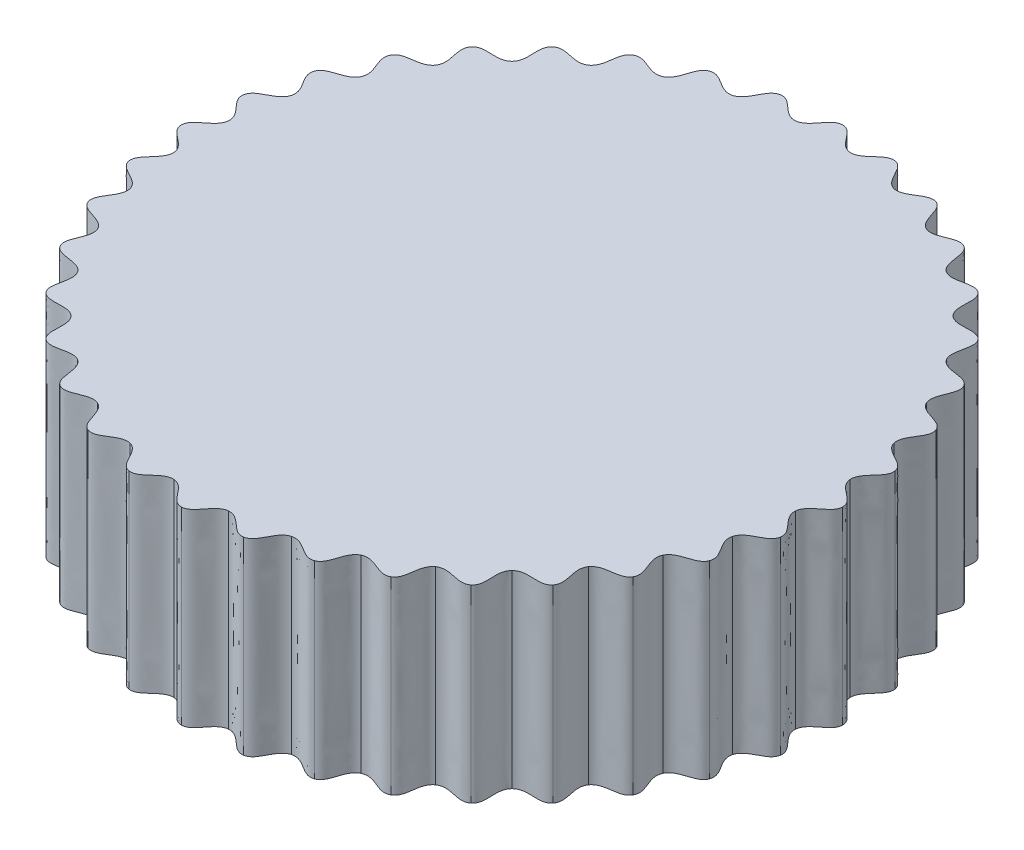
from build123d import *

# Parameters (mm, degrees)
BOSS_EXTRUDE1_DEPTH = 20


with BuildPart() as part:
    # Sketch1 → Boss-Extrude1 (new body)
    with BuildSketch(Plane(origin=(0, 0, 0), x_dir=(1, 0, 0), z_dir=(0, 1, 0))):
        with BuildLine():
            add(Edge.make_bspline(
                [(0, 35), (0.625233227, 35.007554002), (1.438307516, 33.901224637), (2.250430763, 32.938846798), (2.876139511, 32.874425037)],
                knots=[0, 0, 0, 0, 0.5, 1, 1, 1, 1], degree=3))
            add(Edge.make_bspline(
                [(6.077686218, 34.468271355), (5.463263428, 34.584281206), (4.470429486, 33.635948338), (3.503529058, 32.829214903), (2.876139511, 32.874425037)],
                knots=[0, 0, 0, 0, 0.5, 1, 1, 1, 1], degree=3))
            add(Edge.make_bspline(
                [(6.077686218, 34.468271355), (6.694732486, 34.367139985), (7.303342271, 33.13642938), (7.936012384, 32.047648501), (8.541028488, 31.875552268)],
                knots=[0, 0, 0, 0, 0.5, 1, 1, 1, 1], degree=3))
            add(Edge.make_bspline(
                [(11.970705016, 32.889241728), (11.385761588, 33.110182525), (10.24333475, 32.34866077), (9.151035921, 31.722083926), (8.541028488, 31.875552268)],
                knots=[0, 0, 0, 0, 0.5, 1, 1, 1, 1], degree=3))
            add(Edge.make_bspline(
                [(11.970705016, 32.889241728), (12.560815687, 32.68249781), (12.946468668, 31.364800484), (13.380462285, 30.182698621), (13.946402637, 29.908156972)],
                knots=[0, 0, 0, 0, 0.5, 1, 1, 1, 1], degree=3))
            add(Edge.make_bspline(
                [(17.5, 30.310889132), (16.962309143, 30.630047704), (15.705001471, 30.078475513), (14.520493189, 29.65109348), (13.946402637, 29.908156972)],
                knots=[0, 0, 0, 0, 0.5, 1, 1, 1, 1], degree=3))
            add(Edge.make_bspline(
                [(17.5, 30.310889132), (18.045244859, 30.004814477), (18.196223165, 28.640167997), (18.41835361, 27.400662717), (18.9280224, 27.032017462)],
                knots=[0, 0, 0, 0, 0.5, 1, 1, 1, 1], degree=3))
            add(Edge.make_bspline(
                [(22.497566339, 26.811555509), (22.023465519, 27.219234382), (20.68947967, 26.894370998), (19.448752619, 26.679169564), (18.9280224, 27.032017462)],
                knots=[0, 0, 0, 0, 0.5, 1, 1, 1, 1], degree=3))
            add(Edge.make_bspline(
                [(22.497566339, 26.811555509), (22.981378397, 26.415450039), (22.89309463, 25.045318498), (22.89661258, 23.786071542), (23.334523779, 23.334523779)],
                knots=[0, 0, 0, 0, 0.5, 1, 1, 1, 1], degree=3))
            add(Edge.make_bspline(
                [(26.811555509, 22.497566339), (26.415450039, 22.981378397), (25.045318498, 22.89309463), (23.786071542, 22.89661258), (23.334523779, 23.334523779)],
                knots=[0, 0, 0, 0, 0.5, 1, 1, 1, 1], degree=3))
            add(Edge.make_bspline(
                [(26.811555509, 22.497566339), (27.219234382, 22.023465519), (26.894370998, 20.68947967), (26.679169564, 19.448752619), (27.032017462, 18.9280224)],
                knots=[0, 0, 0, 0, 0.5, 1, 1, 1, 1], degree=3))
            add(Edge.make_bspline(
                [(30.310889132, 17.5), (30.004814477, 18.045244859), (28.640167997, 18.196223165), (27.400662717, 18.41835361), (27.032017462, 18.9280224)],
                knots=[0, 0, 0, 0, 0.5, 1, 1, 1, 1], degree=3))
            add(Edge.make_bspline(
                [(30.310889132, 17.5), (30.630047704, 16.962309143), (30.078475513, 15.705001471), (29.65109348, 14.520493189), (29.908156972, 13.946402637)],
                knots=[0, 0, 0, 0, 0.5, 1, 1, 1, 1], degree=3))
            add(Edge.make_bspline(
                [(32.889241728, 11.970705016), (32.68249781, 12.560815687), (31.364800484, 12.946468668), (30.182698621, 13.380462285), (29.908156972, 13.946402637)],
                knots=[0, 0, 0, 0, 0.5, 1, 1, 1, 1], degree=3))
            add(Edge.make_bspline(
                [(32.889241728, 11.970705016), (33.110182525, 11.385761588), (32.34866077, 10.24333475), (31.722083926, 9.151035921), (31.875552268, 8.541028488)],
                knots=[0, 0, 0, 0, 0.5, 1, 1, 1, 1], degree=3))
            add(Edge.make_bspline(
                [(34.468271355, 6.077686218), (34.367139985, 6.694732486), (33.13642938, 7.303342271), (32.047648501, 7.936012384), (31.875552268, 8.541028488)],
                knots=[0, 0, 0, 0, 0.5, 1, 1, 1, 1], degree=3))
            add(Edge.make_bspline(
                [(34.468271355, 6.077686218), (34.584281206, 5.463263428), (33.635948338, 4.470429486), (32.829214903, 3.503529058), (32.874425037, 2.876139511)],
                knots=[0, 0, 0, 0, 0.5, 1, 1, 1, 1], degree=3))
            add(Edge.make_bspline(
                [(35, 0), (35.007554002, 0.625233227), (33.901224637, 1.438307516), (32.938846798, 2.250430763), (32.874425037, 2.876139511)],
                knots=[0, 0, 0, 0, 0.5, 1, 1, 1, 1], degree=3))
            add(Edge.make_bspline(
                [(35, 0), (35.007554002, -0.625233227), (33.901224637, -1.438307516), (32.938846798, -2.250430763), (32.874425037, -2.876139511)],
                knots=[0, 0, 0, 0, 0.5, 1, 1, 1, 1], degree=3))
            add(Edge.make_bspline(
                [(34.468271355, -6.077686218), (34.584281206, -5.463263428), (33.635948338, -4.470429486), (32.829214903, -3.503529058), (32.874425037, -2.876139511)],
                knots=[0, 0, 0, 0, 0.5, 1, 1, 1, 1], degree=3))
            add(Edge.make_bspline(
                [(34.468271355, -6.077686218), (34.367139985, -6.694732486), (33.13642938, -7.303342271), (32.047648501, -7.936012384), (31.875552268, -8.541028488)],
                knots=[0, 0, 0, 0, 0.5, 1, 1, 1, 1], degree=3))
            add(Edge.make_bspline(
                [(32.889241728, -11.970705016), (33.110182525, -11.385761588), (32.34866077, -10.24333475), (31.722083926, -9.151035921), (31.875552268, -8.541028488)],
                knots=[0, 0, 0, 0, 0.5, 1, 1, 1, 1], degree=3))
            add(Edge.make_bspline(
                [(32.889241728, -11.970705016), (32.68249781, -12.560815687), (31.364800484, -12.946468668), (30.182698621, -13.380462285), (29.908156972, -13.946402637)],
                knots=[0, 0, 0, 0, 0.5, 1, 1, 1, 1], degree=3))
            add(Edge.make_bspline(
                [(30.310889132, -17.5), (30.630047704, -16.962309143), (30.078475513, -15.705001471), (29.65109348, -14.520493189), (29.908156972, -13.946402637)],
                knots=[0, 0, 0, 0, 0.5, 1, 1, 1, 1], degree=3))
            add(Edge.make_bspline(
                [(30.310889132, -17.5), (30.004814477, -18.045244859), (28.640167997, -18.196223165), (27.400662717, -18.41835361), (27.032017462, -18.9280224)],
                knots=[0, 0, 0, 0, 0.5, 1, 1, 1, 1], degree=3))
            add(Edge.make_bspline(
                [(26.811555509, -22.497566339), (27.219234382, -22.023465519), (26.894370998, -20.68947967), (26.679169564, -19.448752619), (27.032017462, -18.9280224)],
                knots=[0, 0, 0, 0, 0.5, 1, 1, 1, 1], degree=3))
            add(Edge.make_bspline(
                [(26.811555509, -22.497566339), (26.415450039, -22.981378397), (25.045318498, -22.89309463), (23.786071542, -22.89661258), (23.334523779, -23.334523779)],
                knots=[0, 0, 0, 0, 0.5, 1, 1, 1, 1], degree=3))
            add(Edge.make_bspline(
                [(22.497566339, -26.811555509), (22.981378397, -26.415450039), (22.89309463, -25.045318498), (22.89661258, -23.786071542), (23.334523779, -23.334523779)],
                knots=[0, 0, 0, 0, 0.5, 1, 1, 1, 1], degree=3))
            add(Edge.make_bspline(
                [(22.497566339, -26.811555509), (22.023465519, -27.219234382), (20.68947967, -26.894370998), (19.448752619, -26.679169564), (18.9280224, -27.032017462)],
                knots=[0, 0, 0, 0, 0.5, 1, 1, 1, 1], degree=3))
            add(Edge.make_bspline(
                [(17.5, -30.310889132), (18.045244859, -30.004814477), (18.196223165, -28.640167997), (18.41835361, -27.400662717), (18.9280224, -27.032017462)],
                knots=[0, 0, 0, 0, 0.5, 1, 1, 1, 1], degree=3))
            add(Edge.make_bspline(
                [(17.5, -30.310889132), (16.962309143, -30.630047704), (15.705001471, -30.078475513), (14.520493189, -29.65109348), (13.946402637, -29.908156972)],
                knots=[0, 0, 0, 0, 0.5, 1, 1, 1, 1], degree=3))
            add(Edge.make_bspline(
                [(11.970705016, -32.889241728), (12.560815687, -32.68249781), (12.946468668, -31.364800484), (13.380462285, -30.182698621), (13.946402637, -29.908156972)],
                knots=[0, 0, 0, 0, 0.5, 1, 1, 1, 1], degree=3))
            add(Edge.make_bspline(
                [(11.970705016, -32.889241728), (11.385761588, -33.110182525), (10.24333475, -32.34866077), (9.151035921, -31.722083926), (8.541028488, -31.875552268)],
                knots=[0, 0, 0, 0, 0.5, 1, 1, 1, 1], degree=3))
            add(Edge.make_bspline(
                [(6.077686218, -34.468271355), (6.694732486, -34.367139985), (7.303342271, -33.13642938), (7.936012384, -32.047648501), (8.541028488, -31.875552268)],
                knots=[0, 0, 0, 0, 0.5, 1, 1, 1, 1], degree=3))
            add(Edge.make_bspline(
                [(6.077686218, -34.468271355), (5.463263428, -34.584281206), (4.470429486, -33.635948338), (3.503529058, -32.829214903), (2.876139511, -32.874425037)],
                knots=[0, 0, 0, 0, 0.5, 1, 1, 1, 1], degree=3))
            add(Edge.make_bspline(
                [(0, -35), (0.625233227, -35.007554002), (1.438307516, -33.901224637), (2.250430763, -32.938846798), (2.876139511, -32.874425037)],
                knots=[0, 0, 0, 0, 0.5, 1, 1, 1, 1], degree=3))
            add(Edge.make_bspline(
                [(0, -35), (-0.625233227, -35.007554002), (-1.438307516, -33.901224637), (-2.250430763, -32.938846798), (-2.876139511, -32.874425037)],
                knots=[0, 0, 0, 0, 0.5, 1, 1, 1, 1], degree=3))
            add(Edge.make_bspline(
                [(-6.077686218, -34.468271355), (-5.463263428, -34.584281206), (-4.470429486, -33.635948338), (-3.503529058, -32.829214903), (-2.876139511, -32.874425037)],
                knots=[0, 0, 0, 0, 0.5, 1, 1, 1, 1], degree=3))
            add(Edge.make_bspline(
                [(-6.077686218, -34.468271355), (-6.694732486, -34.367139985), (-7.303342271, -33.13642938), (-7.936012384, -32.047648501), (-8.541028488, -31.875552268)],
                knots=[0, 0, 0, 0, 0.5, 1, 1, 1, 1], degree=3))
            add(Edge.make_bspline(
                [(-11.970705016, -32.889241728), (-11.385761588, -33.110182525), (-10.24333475, -32.34866077), (-9.151035921, -31.722083926), (-8.541028488, -31.875552268)],
                knots=[0, 0, 0, 0, 0.5, 1, 1, 1, 1], degree=3))
            add(Edge.make_bspline(
                [(-11.970705016, -32.889241728), (-12.560815687, -32.68249781), (-12.946468668, -31.364800484), (-13.380462285, -30.182698621), (-13.946402637, -29.908156972)],
                knots=[0, 0, 0, 0, 0.5, 1, 1, 1, 1], degree=3))
            add(Edge.make_bspline(
                [(-17.5, -30.310889132), (-16.962309143, -30.630047704), (-15.705001471, -30.078475513), (-14.520493189, -29.65109348), (-13.946402637, -29.908156972)],
                knots=[0, 0, 0, 0, 0.5, 1, 1, 1, 1], degree=3))
            add(Edge.make_bspline(
                [(-17.5, -30.310889132), (-18.045244859, -30.004814477), (-18.196223165, -28.640167997), (-18.41835361, -27.400662717), (-18.9280224, -27.032017462)],
                knots=[0, 0, 0, 0, 0.5, 1, 1, 1, 1], degree=3))
            add(Edge.make_bspline(
                [(-22.497566339, -26.811555509), (-22.023465519, -27.219234382), (-20.68947967, -26.894370998), (-19.448752619, -26.679169564), (-18.9280224, -27.032017462)],
                knots=[0, 0, 0, 0, 0.5, 1, 1, 1, 1], degree=3))
            add(Edge.make_bspline(
                [(-22.497566339, -26.811555509), (-22.981378397, -26.415450039), (-22.89309463, -25.045318498), (-22.89661258, -23.786071542), (-23.334523779, -23.334523779)],
                knots=[0, 0, 0, 0, 0.5, 1, 1, 1, 1], degree=3))
            add(Edge.make_bspline(
                [(-26.811555509, -22.497566339), (-26.415450039, -22.981378397), (-25.045318498, -22.89309463), (-23.786071542, -22.89661258), (-23.334523779, -23.334523779)],
                knots=[0, 0, 0, 0, 0.5, 1, 1, 1, 1], degree=3))
            add(Edge.make_bspline(
                [(-26.811555509, -22.497566339), (-27.219234382, -22.023465519), (-26.894370998, -20.68947967), (-26.679169564, -19.448752619), (-27.032017462, -18.9280224)],
                knots=[0, 0, 0, 0, 0.5, 1, 1, 1, 1], degree=3))
            add(Edge.make_bspline(
                [(-30.310889132, -17.5), (-30.004814477, -18.045244859), (-28.640167997, -18.196223165), (-27.400662717, -18.41835361), (-27.032017462, -18.9280224)],
                knots=[0, 0, 0, 0, 0.5, 1, 1, 1, 1], degree=3))
            add(Edge.make_bspline(
                [(-30.310889132, -17.5), (-30.630047704, -16.962309143), (-30.078475513, -15.705001471), (-29.65109348, -14.520493189), (-29.908156972, -13.946402637)],
                knots=[0, 0, 0, 0, 0.5, 1, 1, 1, 1], degree=3))
            add(Edge.make_bspline(
                [(-32.889241728, -11.970705016), (-32.68249781, -12.560815687), (-31.364800484, -12.946468668), (-30.182698621, -13.380462285), (-29.908156972, -13.946402637)],
                knots=[0, 0, 0, 0, 0.5, 1, 1, 1, 1], degree=3))
            add(Edge.make_bspline(
                [(-32.889241728, -11.970705016), (-33.110182525, -11.385761588), (-32.34866077, -10.24333475), (-31.722083926, -9.151035921), (-31.875552268, -8.541028488)],
                knots=[0, 0, 0, 0, 0.5, 1, 1, 1, 1], degree=3))
            add(Edge.make_bspline(
                [(-34.468271355, -6.077686218), (-34.367139985, -6.694732486), (-33.13642938, -7.303342271), (-32.047648501, -7.936012384), (-31.875552268, -8.541028488)],
                knots=[0, 0, 0, 0, 0.5, 1, 1, 1, 1], degree=3))
            add(Edge.make_bspline(
                [(-34.468271355, -6.077686218), (-34.584281206, -5.463263428), (-33.635948338, -4.470429486), (-32.829214903, -3.503529058), (-32.874425037, -2.876139511)],
                knots=[0, 0, 0, 0, 0.5, 1, 1, 1, 1], degree=3))
            add(Edge.make_bspline(
                [(-35, 0), (-35.007554002, -0.625233227), (-33.901224637, -1.438307516), (-32.938846798, -2.250430763), (-32.874425037, -2.876139511)],
                knots=[0, 0, 0, 0, 0.5, 1, 1, 1, 1], degree=3))
            add(Edge.make_bspline(
                [(-35, 0), (-35.007554002, 0.625233227), (-33.901224637, 1.438307516), (-32.938846798, 2.250430763), (-32.874425037, 2.876139511)],
                knots=[0, 0, 0, 0, 0.5, 1, 1, 1, 1], degree=3))
            add(Edge.make_bspline(
                [(-34.468271355, 6.077686218), (-34.584281206, 5.463263428), (-33.635948338, 4.470429486), (-32.829214903, 3.503529058), (-32.874425037, 2.876139511)],
                knots=[0, 0, 0, 0, 0.5, 1, 1, 1, 1], degree=3))
            add(Edge.make_bspline(
                [(-34.468271355, 6.077686218), (-34.367139985, 6.694732486), (-33.13642938, 7.303342271), (-32.047648501, 7.936012384), (-31.875552268, 8.541028488)],
                knots=[0, 0, 0, 0, 0.5, 1, 1, 1, 1], degree=3))
            add(Edge.make_bspline(
                [(-32.889241728, 11.970705016), (-33.110182525, 11.385761588), (-32.34866077, 10.24333475), (-31.722083926, 9.151035921), (-31.875552268, 8.541028488)],
                knots=[0, 0, 0, 0, 0.5, 1, 1, 1, 1], degree=3))
            add(Edge.make_bspline(
                [(-32.889241728, 11.970705016), (-32.68249781, 12.560815687), (-31.364800484, 12.946468668), (-30.182698621, 13.380462285), (-29.908156972, 13.946402637)],
                knots=[0, 0, 0, 0, 0.5, 1, 1, 1, 1], degree=3))
            add(Edge.make_bspline(
                [(-30.310889132, 17.5), (-30.630047704, 16.962309143), (-30.078475513, 15.705001471), (-29.65109348, 14.520493189), (-29.908156972, 13.946402637)],
                knots=[0, 0, 0, 0, 0.5, 1, 1, 1, 1], degree=3))
            add(Edge.make_bspline(
                [(-30.310889132, 17.5), (-30.004814477, 18.045244859), (-28.640167997, 18.196223165), (-27.400662717, 18.41835361), (-27.032017462, 18.9280224)],
                knots=[0, 0, 0, 0, 0.5, 1, 1, 1, 1], degree=3))
            add(Edge.make_bspline(
                [(-26.811555509, 22.497566339), (-27.219234382, 22.023465519), (-26.894370998, 20.68947967), (-26.679169564, 19.448752619), (-27.032017462, 18.9280224)],
                knots=[0, 0, 0, 0, 0.5, 1, 1, 1, 1], degree=3))
            add(Edge.make_bspline(
                [(-26.811555509, 22.497566339), (-26.415450039, 22.981378397), (-25.045318498, 22.89309463), (-23.786071542, 22.89661258), (-23.334523779, 23.334523779)],
                knots=[0, 0, 0, 0, 0.5, 1, 1, 1, 1], degree=3))
            add(Edge.make_bspline(
                [(-22.497566339, 26.811555509), (-22.981378397, 26.415450039), (-22.89309463, 25.045318498), (-22.89661258, 23.786071542), (-23.334523779, 23.334523779)],
                knots=[0, 0, 0, 0, 0.5, 1, 1, 1, 1], degree=3))
            add(Edge.make_bspline(
                [(-22.497566339, 26.811555509), (-22.023465519, 27.219234382), (-20.68947967, 26.894370998), (-19.448752619, 26.679169564), (-18.9280224, 27.032017462)],
                knots=[0, 0, 0, 0, 0.5, 1, 1, 1, 1], degree=3))
            add(Edge.make_bspline(
                [(-17.5, 30.310889132), (-18.045244859, 30.004814477), (-18.196223165, 28.640167997), (-18.41835361, 27.400662717), (-18.9280224, 27.032017462)],
                knots=[0, 0, 0, 0, 0.5, 1, 1, 1, 1], degree=3))
            add(Edge.make_bspline(
                [(-17.5, 30.310889132), (-16.962309143, 30.630047704), (-15.705001471, 30.078475513), (-14.520493189, 29.65109348), (-13.946402637, 29.908156972)],
                knots=[0, 0, 0, 0, 0.5, 1, 1, 1, 1], degree=3))
            add(Edge.make_bspline(
                [(-11.970705016, 32.889241728), (-12.560815687, 32.68249781), (-12.946468668, 31.364800484), (-13.380462285, 30.182698621), (-13.946402637, 29.908156972)],
                knots=[0, 0, 0, 0, 0.5, 1, 1, 1, 1], degree=3))
            add(Edge.make_bspline(
                [(-11.970705016, 32.889241728), (-11.385761588, 33.110182525), (-10.24333475, 32.34866077), (-9.151035921, 31.722083926), (-8.541028488, 31.875552268)],
                knots=[0, 0, 0, 0, 0.5, 1, 1, 1, 1], degree=3))
            add(Edge.make_bspline(
                [(-6.077686218, 34.468271355), (-6.694732486, 34.367139985), (-7.303342271, 33.13642938), (-7.936012384, 32.047648501), (-8.541028488, 31.875552268)],
                knots=[0, 0, 0, 0, 0.5, 1, 1, 1, 1], degree=3))
            add(Edge.make_bspline(
                [(-6.077686218, 34.468271355), (-5.463263428, 34.584281206), (-4.470429486, 33.635948338), (-3.503529058, 32.829214903), (-2.876139511, 32.874425037)],
                knots=[0, 0, 0, 0, 0.5, 1, 1, 1, 1], degree=3))
            add(Edge.make_bspline(
                [(0, 35), (-0.625233227, 35.007554002), (-1.438307516, 33.901224637), (-2.250430763, 32.938846798), (-2.876139511, 32.874425037)],
                knots=[0, 0, 0, 0, 0.5, 1, 1, 1, 1], degree=3))
        make_face()
    extrude(amount=BOSS_EXTRUDE1_DEPTH)


solid = part.part
